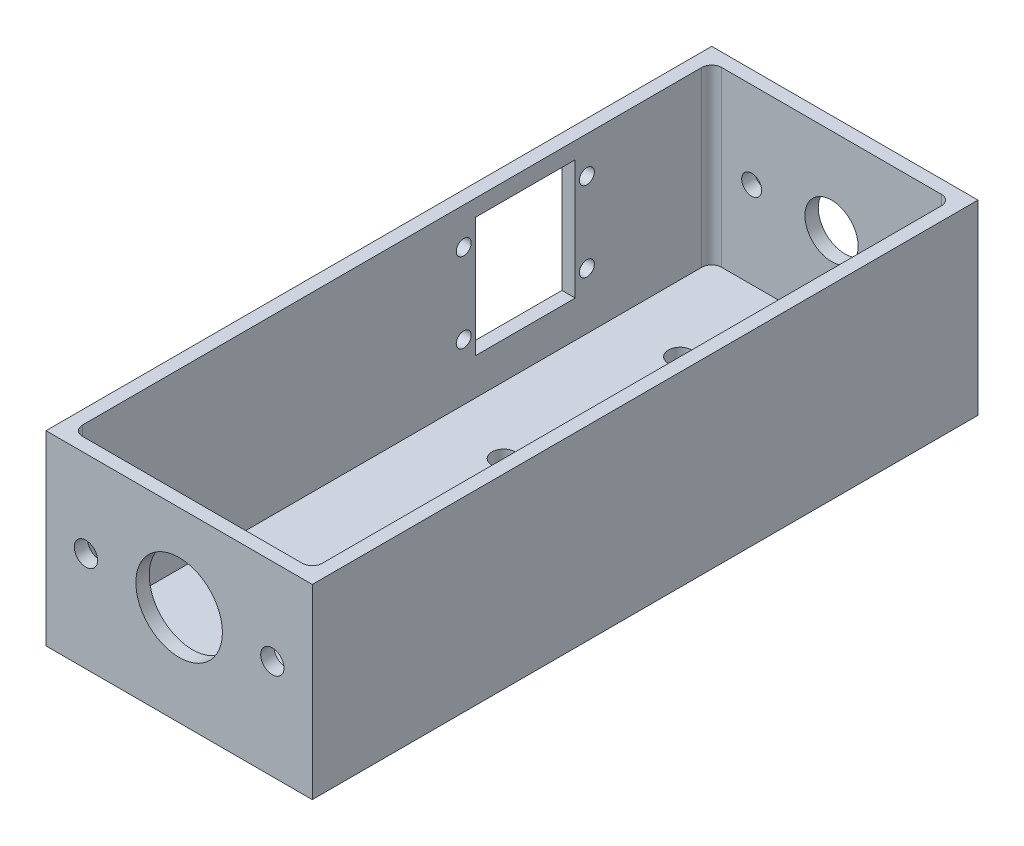
from build123d import *

# Parameters (mm, degrees)
SKETCH_1_W          = 80
SKETCH_1_H          = 56
EXTRUDE_1_DEPTH     = 200
CUT_EXTRUDE_1_DEPTH = 52
SKETCH_3_R          = 3.5
SKETCH_3_R_2        = 13
CUT_EXTRUDE_2_DEPTH = 10
SKETCH_4_W          = 30
SKETCH_4_H          = 36
CUT_EXTRUDE_3_DEPTH = 10
SKETCH_5_R          = 8
SKETCH_5_R_2        = 3
CUT_EXTRUDE_4_DEPTH = 10
SKETCH_6_R          = 3.500000002
SKETCH_6_R_2        = 3.5
CUT_EXTRUDE_5_DEPTH = 10
SKETCH_9_R          = 2.25
CUT_EXTRUDE_6_DEPTH = 10


with BuildPart() as part:
    # 草图1 → 凸台-拉伸1 (new body)
    with BuildSketch(Plane.XY):
        Rectangle(SKETCH_1_W, SKETCH_1_H)
    extrude(amount=-EXTRUDE_1_DEPTH)

    # 草图2 → 切除-拉伸1 (cut)
    with BuildSketch(Plane(origin=(0, 28, 0), x_dir=(1, 0, 0), z_dir=(0, 1, 0))):
        with BuildLine():
            ThreePointArc((-33, 196), (-35.121320344, 195.121320344), (-36, 193))
            Line((-36, 193), (-36, 7))
            ThreePointArc((-36, 7), (-35.121320344, 4.878679656), (-33, 4))
            Line((-33, 4), (33, 4))
            ThreePointArc((33, 4), (35.121320344, 4.878679656), (36, 7))
            Line((36, 7), (36, 193))
            ThreePointArc((36, 193), (35.121320344, 195.121320344), (33, 196))
            Line((33, 196), (-33, 196))
        make_face()
    extrude(amount=-CUT_EXTRUDE_1_DEPTH, mode=Mode.SUBTRACT)

    # 草图3 → 切除-拉伸2 (cut)
    with BuildSketch(Plane.XY):
        with Locations((-28, 2)):
            Circle(SKETCH_3_R)
        with Locations((0, 2)):
            Circle(SKETCH_3_R_2)
        with Locations((28, 2)):
            Circle(SKETCH_3_R)
    extrude(amount=-CUT_EXTRUDE_2_DEPTH, mode=Mode.SUBTRACT)

    # 草图4 → 切除-拉伸3 (cut)
    with BuildSketch(Plane.ZY.offset(40)):
        with Locations((-140, 5)):
            Rectangle(SKETCH_4_W, SKETCH_4_H)
    extrude(amount=-CUT_EXTRUDE_3_DEPTH, mode=Mode.SUBTRACT)

    # 草图5 → 切除-拉伸4 (cut)
    with BuildSketch(Plane(origin=(0, 0, -200), x_dir=(-1, 0, 0), z_dir=(0, 0, -1))):
        with Locations((0, 2)):
            Circle(SKETCH_5_R)
        with Locations((24, 2)):
            Circle(SKETCH_5_R_2)
        with Locations((-24, 2)):
            Circle(SKETCH_5_R_2)
    extrude(amount=-CUT_EXTRUDE_4_DEPTH, mode=Mode.SUBTRACT)

    # 草图6 → 切除-拉伸5 (cut)
    with BuildSketch(Plane(origin=(0, -24, 0), x_dir=(1, 0, 0), z_dir=(0, 1, 0))):
        with Locations((-16, 166.5)):
            Circle(SKETCH_6_R)
        with Locations((-16, 113.5)):
            Circle(SKETCH_6_R_2)
    extrude(amount=-CUT_EXTRUDE_5_DEPTH, mode=Mode.SUBTRACT)

    # 草图9 → 切除-拉伸6 (cut)
    with BuildSketch(Plane.ZY.offset(40)):
        with Locations((-121.5, -7.017700118)):
            Circle(SKETCH_9_R)
        with Locations((-158.5, -7.017700118)):
            Circle(SKETCH_9_R)
        with Locations((-158.5, 16.982299882)):
            Circle(SKETCH_9_R)
        with Locations((-121.5, 16.982299882)):
            Circle(SKETCH_9_R)
    extrude(amount=-CUT_EXTRUDE_6_DEPTH, mode=Mode.SUBTRACT)


solid = part.part
